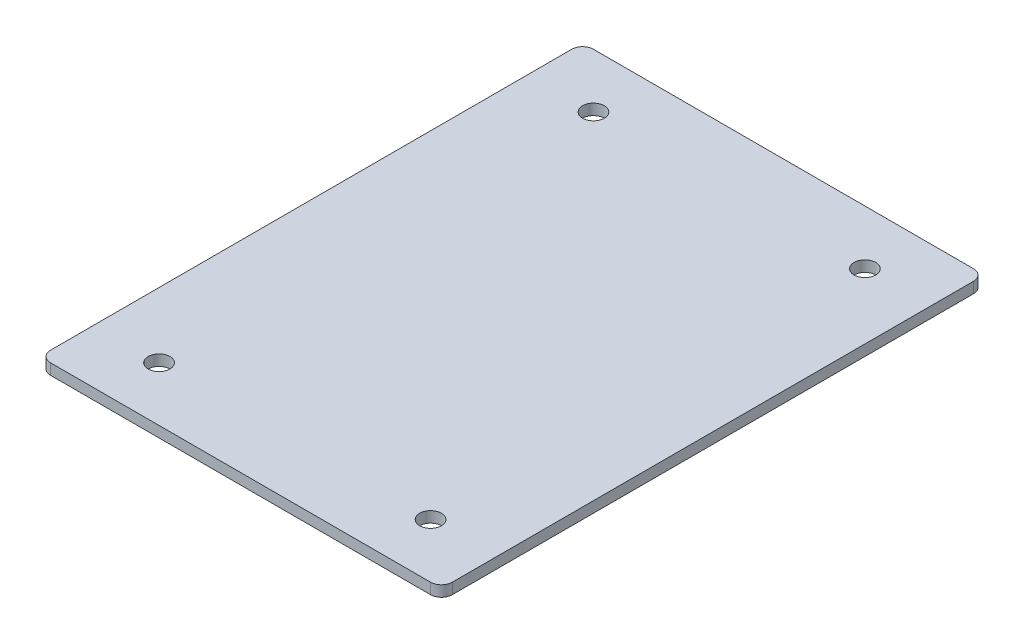
from build123d import *

# Parameters (mm, degrees)
SKETCH1_W           = 74
SKETCH1_H           = 100
BOSS_EXTRUDE1_DEPTH = 2
FILLET1_R           = 2
SKETCH2_R           = 2
CUT_EXTRUDE1_DEPTH  = 125.41864812


with BuildPart() as part:
    # Sketch1 → Boss-Extrude1 (new body)
    with BuildSketch(Plane(origin=(0, 0, 0), x_dir=(1, 0, 0), z_dir=(0, 1, 0))):
        with Locations((37, 50)):
            Rectangle(SKETCH1_W, SKETCH1_H)
    extrude(amount=BOSS_EXTRUDE1_DEPTH)

    # Fillet1
    fillet1_edges = [part.edges().sort_by_distance(p)[0] for p in [
        (0, 1, -100),
        (74, 1, -100),
        (0, 1, 0),
        (74, 1, 0),
    ]]
    fillet(fillet1_edges, radius=FILLET1_R)

    # Sketch2 → Cut-Extrude1 (cut, through all)
    with BuildSketch(Plane(origin=(0, 2, 0), x_dir=(1, 0, 0), z_dir=(0, 1, 0))):
        with Locations((12, 90)):
            Circle(SKETCH2_R)
        with Locations((62, 90)):
            Circle(SKETCH2_R)
        with Locations((62, 10)):
            Circle(SKETCH2_R)
        with Locations((12, 10)):
            Circle(SKETCH2_R)
    extrude(amount=-CUT_EXTRUDE1_DEPTH, mode=Mode.SUBTRACT)


solid = part.part
